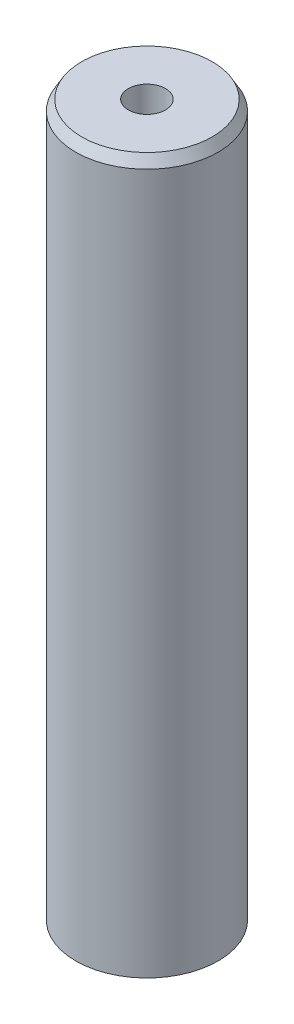
from build123d import *
from OCP.BRepFilletAPI import BRepFilletAPI_MakeChamfer

# Parameters (mm, degrees)
SKETCH1_R           = 7.5
BOSS_EXTRUDE1_DEPTH = 75.511682669
SKETCH2_R           = 1.958551668
CUT_EXTRUDE1_DEPTH  = 77.252962037
CHAMFER1_SIZE       = 1.084322303
CHAMFER1_SIZE2      = 0.626033774


with BuildPart() as part:
    # Sketch1 → Boss-Extrude1 (new body)
    with BuildSketch(Plane(origin=(0, 0, 0), x_dir=(1, 0, 0), z_dir=(0, 1, 0))):
        Circle(SKETCH1_R)
    extrude(amount=BOSS_EXTRUDE1_DEPTH)

    # Sketch2 → Cut-Extrude1 (cut, through all)
    with BuildSketch(Plane(origin=(0, 0, 0), x_dir=(1, 0, 0), z_dir=(0, 1, 0))):
        Circle(SKETCH2_R)
    extrude(amount=CUT_EXTRUDE1_DEPTH, mode=Mode.SUBTRACT)

    # Chamfer1: one chamfer whose edges measure the first distance from different faces: ONE call of the kernel's chamfer builder (chamfer() names one face for all edges)
    chamfer1_edges_1 = [part.edges().sort_by_distance(p)[0] for p in [
        (-7.5, 75.511682669, 0),
    ]]
    chamfer1_side_1 = [part.faces().sort_by_distance(p)[0] for p in [
        (-7.5, 37.755841334, 0),
    ]]
    chamfer1_edges_2 = [part.edges().sort_by_distance(p)[0] for p in [
        (-7.5, 0, 0),
    ]]
    chamfer1_side_2 = [part.faces().sort_by_distance(p)[0] for p in [
        (-7.287867966, 0, 0),
    ]]
    chamfer1 = BRepFilletAPI_MakeChamfer(part.part.solid().wrapped)
    for e in chamfer1_edges_1:
        chamfer1.Add(CHAMFER1_SIZE, CHAMFER1_SIZE2, e.wrapped, chamfer1_side_1[0].wrapped)  # the first distance lies on this face
    for e in chamfer1_edges_2:
        chamfer1.Add(CHAMFER1_SIZE, CHAMFER1_SIZE2, e.wrapped, chamfer1_side_2[0].wrapped)  # the first distance lies on this face
    add(Compound.cast(chamfer1.Shape()), mode=Mode.REPLACE)


solid = part.part
